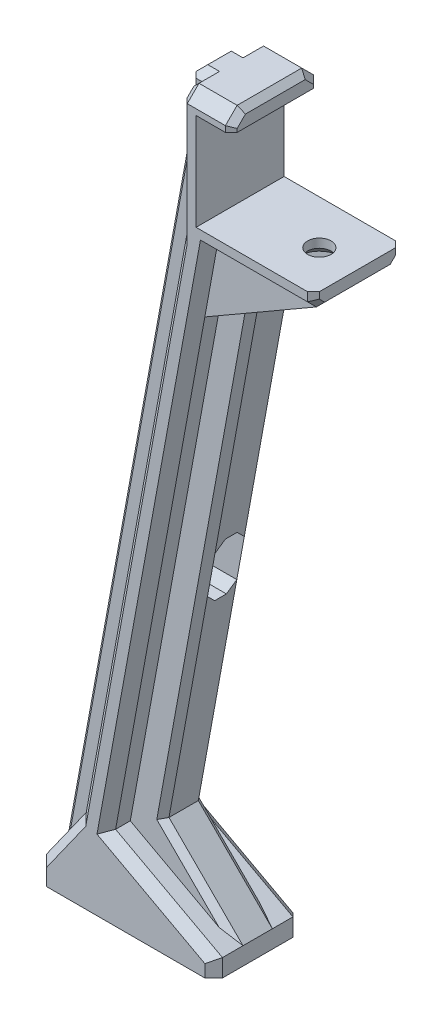
from build123d import *

# Parameters (mm, degrees)
RESSALTO_EXTRUS_O1_DEPTH  = 15
ESBO_O7_W                 = 30
ESBO_O7_H                 = 15
RESSALTO_EXTRUS_O3_DEPTH  = 3
ESBO_O14_W                = 7
ESBO_O14_H                = 107.753429602
RESSALTO_EXTRUS_O5_DEPTH  = 2
ESBO_O15_W                = 7
ESBO_O15_H                = 107.852923352
RESSALTO_EXTRUS_O6_DEPTH  = 2
ESBO_O16_W                = 7
ESBO_O16_H                = 22.5
RESSALTO_EXTRUS_O9_DEPTH  = 2
CHANFRO11_SIZE            = 20.026147127
CHANFRO11_SIZE_2          = 10
CHANFRO12_SIZE            = 5.181688732
CHANFRO12_SIZE_2          = 10
CHANFRO13_SIZE            = 2
CHANFRO14_SIZE            = 4.8
CHANFRO14_SIZE2           = 5.970145796
CHANFRO16_SIZE            = 1.5
CHANFRO17_SIZE            = 1.5
CHANFRO18_SIZE            = 1
ESBO_O17_R                = 2
CORTE_EXTRUS_O1_DEPTH     = 5
CHANFRO20_SIZE            = 1
RESSALTO_EXTRUS_O10_DEPTH = 7
RESSALTO_EXTRUS_O11_DEPTH = 2
RESSALTO_EXTRUS_O13_DEPTH = 2
ESBO_O23_W                = 5
ESBO_O23_H                = 10
CORTE_EXTRUS_O2_DEPTH     = 60
CHANFRO22_SIZE            = 1.5
CHANFRO21_SIZE            = 1


# Some blends are built 0.0001 mm under size
with BuildPart() as part:
    # Esboço2 → Ressalto-extrusão1 (new body)
    with BuildSketch(Plane.XY):
        Polygon((-41.65, 8.85), (-41.65, 11.85), (-50.65, 11.85), (-50.65, -10.65), (-27.65, -10.65), (-27.65, -7.65), (-47.65, -7.65), (-47.65, 8.85), align=None)
    extrude(amount=RESSALTO_EXTRUS_O1_DEPTH)



with BuildPart() as body_2:
    # Esboço7 → Ressalto-extrusão3 (new body)
    with BuildSketch(Plane(origin=(0, -117.65, 0), x_dir=(-1, 0, 0), z_dir=(0, -1, 0))):
        with Locations((59.65, -7.5)):
            Rectangle(ESBO_O7_W, ESBO_O7_H)
    extrude(amount=-RESSALTO_EXTRUS_O3_DEPTH)


with BuildPart() as part_1:
    add(part.part)

    add(body_2.part)  # Loft3 merges body 2
    # Esboço9 → Loft3 section 0
    with BuildSketch(Plane(origin=(0, -114.65, 0), x_dir=(1, 0, 0), z_dir=(0, 1, 0))):
        with BuildLine():
            Line((-69.65, -15), (-64.65, -15))
            Line((-64.65, -15), (-64.65, 0))
            Line((-64.65, 0), (-69.65, 0))
            Line((-69.65, 0), (-69.65, -15))
        make_face()
    # Esboço8 → Loft3 section 1
    with BuildSketch(Plane.XZ.offset(10.65)):
        with BuildLine():
            Line((-50.65, 15), (-45.65, 15))
            Line((-45.65, 15), (-45.65, 0))
            Line((-45.65, 0), (-50.65, 0))
            Line((-50.65, 0), (-50.65, 15))
        make_face()
    loft()

    # Esboço14 → Ressalto-extrusão5 (add)
    with BuildSketch(Plane(origin=(-42.292744028, 7.726559005, 0), x_dir=(0, 0, -1), z_dir=(0.9837182167305484, -0.17971775113346497, 0))):
        with Locations((-7.5, -70.525331358)):
            Rectangle(ESBO_O14_W, ESBO_O14_H)
    extrude(amount=RESSALTO_EXTRUS_O5_DEPTH)

    # Esboço15 → Ressalto-extrusão6 (add)
    with BuildSketch(Plane(origin=(-47.131251678, 8.610517133, 0), x_dir=(0, 0, 1), z_dir=(-0.9837182167305483, 0.17971775113346522, 0))):
        with Locations((7.5, -73.505764779)):
            Rectangle(ESBO_O15_W, ESBO_O15_H)
    extrude(amount=RESSALTO_EXTRUS_O6_DEPTH)

    # Esboço16 → Ressalto-extrusão9 (add)
    with BuildSketch(Plane.ZY.offset(50.65)):
        with Locations((7.5, 0.6)):
            Rectangle(ESBO_O16_W, ESBO_O16_H)
    extrude(amount=RESSALTO_EXTRUS_O9_DEPTH)

    # Chanfro11
    # the kernel refuses this chamfer: 20.026147127, 10 mm, written as the material it adds along each edge
    with BuildSketch(Plane(origin=(-64.65, -114.65, 55.83646579), x_dir=(0.9998316750706326, -0.018347248443652868, 0), z_dir=(0, 0, -1))) as chanfro11_piece_1_section:
        Polygon((CHANFRO11_SIZE * 0.999831675085, -CHANFRO11_SIZE * 0.0183472484439), (CHANFRO11_SIZE_2 * 0.161638977635, -CHANFRO11_SIZE_2 * 0.986849958661), (0, 0), align=None)
    chanfro11_piece_1 = extrude(amount=55.83646579, mode=Mode.PRIVATE)
    chanfro11_piece_1 = split(chanfro11_piece_1, bisect_by=Plane(origin=(-44.65, -111.70383057, 13), z_dir=(-1, 0, 0)), keep=Keep.TOP, mode=Mode.PRIVATE)
    chanfro11_piece_1 = split(chanfro11_piece_1, bisect_by=Plane(origin=(-56.081001228, -111.70383057, 15), z_dir=(0, 0, -1)), keep=Keep.TOP, mode=Mode.PRIVATE)
    add(chanfro11_piece_1)

    # Chanfro12
    # the kernel refuses this chamfer: 10, 5.181688732 mm, written as the material it adds along each edge
    with BuildSketch(Plane(origin=(-69.65, -114.65, -14.909754714), x_dir=(-0.9981888061534079, -0.06015901653147684, 0), z_dir=(0, 0, 1))) as chanfro12_piece_1_section:
        Polygon((CHANFRO12_SIZE * 0.99818880622, -CHANFRO12_SIZE * 0.0601590165355), (-CHANFRO12_SIZE_2 * 0.238571767911, -CHANFRO12_SIZE_2 * 0.971124869188), (0, 0), align=None)
    chanfro12_piece_1 = extrude(amount=29.909754714, mode=Mode.PRIVATE)
    chanfro12_piece_1 = split(chanfro12_piece_1, bisect_by=Plane(origin=(-74.65, -111.318186465, 5.5), z_dir=(1, 0, 0)), keep=Keep.TOP, mode=Mode.PRIVATE)
    chanfro12_piece_1 = split(chanfro12_piece_1, bisect_by=Plane(origin=(-70.664221075, -111.318186465, 0), z_dir=(0, 0, 1)), keep=Keep.TOP, mode=Mode.PRIVATE)
    add(chanfro12_piece_1)

    # Chanfro13
    chanfro13_edges = [part_1.edges().sort_by_distance(p)[0] for p in [
        (-46.15, 11.85, 15),
        (-46.15, 11.85, 0),
    ]]
    chamfer(chanfro13_edges, length=CHANFRO13_SIZE)

    # Chanfro14
    chanfro14_edges = [part_1.edges().sort_by_distance(p)[0] for p in [
        (-43.616897465, -10.65, 7.5),
    ]]
    chanfro14_side = [part_1.faces().sort_by_distance(p)[0] for p in [
        (-52.309535597, -58.230756092, 7.5),
    ]]
    chamfer(chanfro14_edges, length=CHANFRO14_SIZE, length2=CHANFRO14_SIZE2, reference=chanfro14_side[0])

    # Chanfro16
    chanfro16_edges = [part_1.edges().sort_by_distance(p)[0] for p in [
        (-50.65, 11.85, 3),
        (-51.65, 11.85, 11),
        (-51.65, 11.85, 4),
        (-52.65, 11.85, 7.5),
        (-54.251411244, -57.731408916, 0),
        (-54.251411244, -57.731408916, 15),
        (-53.751411244, -109.724353826, 0),
        (-53.751411244, -109.724353826, 15),
        (-59.251411244, -57.731408916, 15),
        (-59.251411244, -57.731408916, 0),
        (-71.251411244, -109.603357662, 15),
        (-71.251411244, -109.603357662, 0),
        (-50.65, 11.85, 12),
        (-50.65, -0.4, 0),
        (-50.65, 10.85, 1),
        (-50.65, -0.4, 15),
        (-50.65, 10.85, 14),
        (-74.65, -116.021948745, 0),
        (-74.65, -116.021948745, 15),
        (-44.65, -116.14294491, 15),
        (-44.65, -116.14294491, 0),
    ]]
    chamfer(chanfro16_edges, length=CHANFRO16_SIZE)

    # Chanfro17
    chanfro17_edges = [part_1.edges().sort_by_distance(p)[0] for p in [
        (-37.412413451, -10.65, 0),
        (-37.412413451, -10.65, 15),
    ]]
    chamfer(chanfro17_edges, length=CHANFRO17_SIZE)

    # Chanfro18
    chanfro18_edges = [part_1.edges().sort_by_distance(p)[0] for p in [
        (-61.620535422, -59.570685278, 4),
        (-52.65, -0.059403589, 11),
        (-52.7408582, -60.591679812, 4),
        (-61.620535422, -59.570685278, 11),
        (-52.7408582, -60.591679812, 11),
        (-41.06314717, -13.01092372, 4),
        (-41.06314717, -13.01092372, 11),
        (-52.65, -0.059403589, 4),
    ]]
    chamfer(chanfro18_edges, length=CHANFRO18_SIZE)

    # Esboço17 → Corte-extrusão1 (cut)
    with BuildSketch(Plane.XZ.offset(10.65)):
        with Locations(Location((-34.15, 7.5, 0), (0, 0, 270))):
            Circle(ESBO_O17_R)
    extrude(amount=-CORTE_EXTRUS_O1_DEPTH, mode=Mode.SUBTRACT)

    # Chanfro20
    chanfro20_edges = [part_1.edges().sort_by_distance(p)[0] for p in [
        (-41.65, 11.85, 7.5),
        (-41.65, 10.85, 14),
        (-41.65, 10.85, 1),
        (-41.65, 9.35, 15),
        (-27.65, -10.65, 7.5),
        (-27.65, -8.4, 0),
        (-27.65, -8.4, 15),
        (-27.65, -9.9, 14.25),
        (-27.65, -9.9, 0.75),
        (-41.65, 9.35, 0),
    ]]
    chamfer(chanfro20_edges, length=CHANFRO20_SIZE)

    # Esboço18 → Ressalto-extrusão10 (add)
    with BuildSketch(Plane.XY.offset(11)):
        Polygon((-44.65, -114.635889819), (-57.26077437, -102.025115449), (-40.293205201, -9.15), (-44.359410271, -9.15), (-60.698866461, -98.587023358), (-61.558389484, -97.727500335), (-67.574940752, -97.727500335), (-51.65, -10.559403589), (-51.65, 10.35), (-52.65, 10.35), (-52.65, 6.027155141), (-74.65, -114.393897491), (-64.647422179, -114.635889819), align=None)
    extrude(amount=-RESSALTO_EXTRUS_O10_DEPTH)

    # Esboço19 → Ressalto-extrusão11 (add)
    with BuildSketch(Plane(origin=(0, 0, 1.5), x_dir=(-1, 0, 0), z_dir=(0, 0, -1))):
        Polygon((28.65, -10.65), (49.35917828, -22.606449655), (46.90078844, -9.15), (46.90078844, -7.65), (28.65, -7.65), align=None)
    extrude(amount=-RESSALTO_EXTRUS_O11_DEPTH)

    # Esboço21 → Ressalto-extrusão13 (add)
    with BuildSketch(Plane.XY.offset(13.5)):
        Polygon((-28.65, -10.65), (-49.35917828, -22.606449655), (-46.90078844, -9.15), (-46.90078844, -7.65), (-28.65, -7.65), align=None)
    extrude(amount=-RESSALTO_EXTRUS_O13_DEPTH)

    # Esboço23 → Corte-extrusão2 (cut)
    with BuildSketch(Plane(origin=(0, 0, 0), x_dir=(0, 0, -1), z_dir=(1, 0, 0))):
        with Locations((-7.5, -62.65)):
            Rectangle(ESBO_O23_W, ESBO_O23_H)
    extrude(amount=-CORTE_EXTRUS_O2_DEPTH, mode=Mode.SUBTRACT)

    # Chanfro22
    chanfro22_edges = [part_1.edges().sort_by_distance(p)[0] for p in [
        (-55.490352601, -67.65, 10),
        (-54.576891062, -57.65, 10),
        (-54.576891062, -57.65, 5),
        (-55.490352601, -67.65, 5),
    ]]
    chamfer(chanfro22_edges, length=CHANFRO22_SIZE)

    # Chanfro21
    chanfro21_edges = [part_1.edges().sort_by_distance(p)[0] for p in [
        (-50.955387185, -108.330502634, 11),
        (-50.955387185, -108.330502634, 4),
        (-48.997924928, -56.796886925, 11),
        (-48.997924928, -56.796886925, 4),
        (-52.65, 8.18857757, 4),
        (-63.65, -54.183371175, 11),
        (-63.65, -54.183371175, 4),
        (-52.65, 8.18857757, 11),
    ]]
    chamfer(chanfro21_edges, length=CHANFRO21_SIZE - 0.0001)  # a hair under: the kernel refuses the full size

    # Esboço26 → Corte-Revolução1 (revolve, cut)
    with BuildSketch(Plane.XY.offset(7.5), mode=Mode.PRIVATE) as corte_revolu_o1_sk:
        Polygon((-30.65, -11.703246541), (-30.65, -10.65), (-34.15, -7.15), (-34.15, -10.65), (-34.15, -11.703246541), align=None)
    revolve(corte_revolu_o1_sk.sketch.rotate(Axis((-34.15, -7.15, 7.5), (0, -1, 0)), 270), axis=Axis((-34.15, -7.15, 7.5), (0, -1, 0)), mode=Mode.SUBTRACT)


solid = part_1.part
